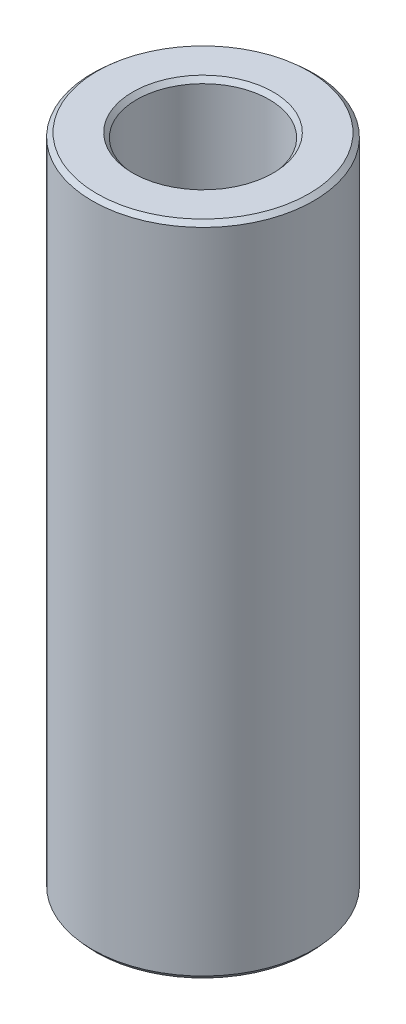
from build123d import *
from OCP.BRepFilletAPI import BRepFilletAPI_MakeChamfer

# Parameters (mm, degrees)
SKETCH1_R           = 37.5
BOSS_EXTRUDE1_DEPTH = 222.663709107
SKETCH2_R           = 22.460077837
CUT_EXTRUDE1_DEPTH  = 229.892174076
CHAMFER1_SIZE       = 1.357148637
CHAMFER1_SIZE2      = 1.545066308


with BuildPart() as part:
    # Sketch1 → Boss-Extrude1 (new body)
    with BuildSketch(Plane(origin=(0, 0, 0), x_dir=(1, 0, 0), z_dir=(0, 1, 0))):
        Circle(SKETCH1_R)
    extrude(amount=BOSS_EXTRUDE1_DEPTH)

    # Sketch2 → Cut-Extrude1 (cut, through all)
    with BuildSketch(Plane(origin=(0, 0, 0), x_dir=(1, 0, 0), z_dir=(0, 1, 0))):
        Circle(SKETCH2_R)
    extrude(amount=CUT_EXTRUDE1_DEPTH, mode=Mode.SUBTRACT)

    # Chamfer1: one chamfer whose edges measure the first distance from different faces: ONE call of the kernel's chamfer builder (chamfer() names one face for all edges)
    chamfer1_edges_1 = [part.edges().sort_by_distance(p)[0] for p in [
        (-22.460077837, 222.663709107, 0),
    ]]
    chamfer1_side_1 = [part.faces().sort_by_distance(p)[0] for p in [
        (-36.439339828, 222.663709107, 0),
    ]]
    chamfer1_edges_2 = [part.edges().sort_by_distance(p)[0] for p in [
        (-22.460077837, 0, 0),
    ]]
    chamfer1_side_2 = [part.faces().sort_by_distance(p)[0] for p in [
        (-22.460077837, 111.331854554, 0),
    ]]
    chamfer1_edges_3 = [part.edges().sort_by_distance(p)[0] for p in [
        (-37.5, 0, 0),
    ]]
    chamfer1_side_3 = [part.faces().sort_by_distance(p)[0] for p in [
        (-36.439339828, 0, 0),
    ]]
    chamfer1_edges_4 = [part.edges().sort_by_distance(p)[0] for p in [
        (-37.5, 222.663709107, 0),
    ]]
    chamfer1_side_4 = [part.faces().sort_by_distance(p)[0] for p in [
        (-37.5, 111.331854554, 0),
    ]]
    chamfer1 = BRepFilletAPI_MakeChamfer(part.part.solid().wrapped)
    for e in chamfer1_edges_1:
        chamfer1.Add(CHAMFER1_SIZE, CHAMFER1_SIZE2, e.wrapped, chamfer1_side_1[0].wrapped)  # the first distance lies on this face
    for e in chamfer1_edges_2:
        chamfer1.Add(CHAMFER1_SIZE, CHAMFER1_SIZE2, e.wrapped, chamfer1_side_2[0].wrapped)  # the first distance lies on this face
    for e in chamfer1_edges_3:
        chamfer1.Add(CHAMFER1_SIZE, CHAMFER1_SIZE2, e.wrapped, chamfer1_side_3[0].wrapped)  # the first distance lies on this face
    for e in chamfer1_edges_4:
        chamfer1.Add(CHAMFER1_SIZE, CHAMFER1_SIZE2, e.wrapped, chamfer1_side_4[0].wrapped)  # the first distance lies on this face
    add(Compound.cast(chamfer1.Shape()), mode=Mode.REPLACE)


solid = part.part
